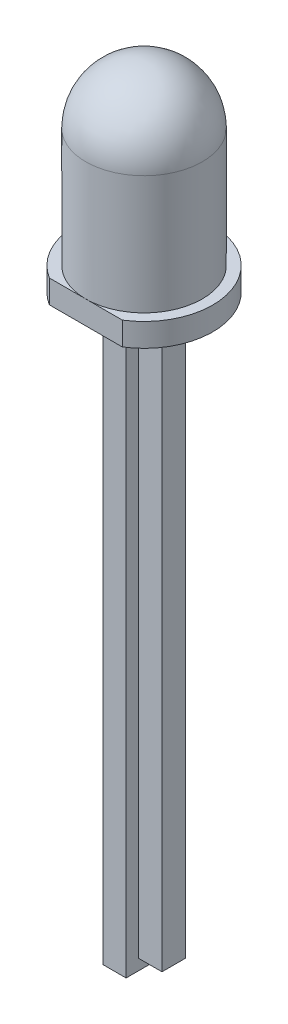
from build123d import *

# Parameters (mm, degrees)
SKETCH1_W           = 2.54
SKETCH1_H           = 1
BASE_EXTRUDE_DEPTH  = 0.381
SKETCH2_W           = 1
SKETCH2_H           = 1
BOSS_EXTRUDE1_DEPTH = 24
SKETCH7_W           = 1
SKETCH7_H           = 1
BOSS_EXTRUDE4_DEPTH = 1
FILLET5_R           = 0.254
BOSS_EXTRUDE2_DEPTH = 1
SKETCH4_R           = 2.5
BOSS_EXTRUDE3_DEPTH = 7.6
FILLET4_R           = 2.5
SKETCH6_W           = 0.032
SKETCH6_H           = 0.381
CUT_EXTRUDE1_DEPTH  = 26.509623674


with BuildPart() as part:
    # Sketch1 → Base-Extrude (new body)
    with BuildSketch(Plane(origin=(0, 0, 0), x_dir=(1, 0, 0), z_dir=(0, 1, 0))):
        with Locations((0.77, 0)):
            Rectangle(SKETCH1_W, SKETCH1_H)
    extrude(amount=BASE_EXTRUDE_DEPTH)

    # Sketch2 → Boss-Extrude1 (add)
    with BuildSketch(Plane.XZ):
        Rectangle(SKETCH2_W, SKETCH2_H)
        with Locations((1.54, 0)):
            Rectangle(SKETCH2_W, SKETCH2_H)
    extrude(amount=BOSS_EXTRUDE1_DEPTH)

    # Sketch7 → Boss-Extrude4 (add)
    with BuildSketch(Plane.XZ.offset(24)):
        Rectangle(SKETCH7_W, SKETCH7_H)
    extrude(amount=BOSS_EXTRUDE4_DEPTH)

    # Fillet5
    fillet5_edges = [part.edges().sort_by_distance(p)[0] for p in [
        (-0.5, 0.381, 0),
        (2.04, 0.381, 0),
        (0.5, 0, 0),
        (1.04, 0, 0),
    ]]
    fillet(fillet5_edges, radius=FILLET5_R)

    # Sketch3 → Boss-Extrude2 (add)
    with BuildSketch(Plane(origin=(0, 0.381, 0), x_dir=(-1, 0, 0), z_dir=(0, 1, 0))):
        with BuildLine():
            Line((-2.336045976, 2.5), (0.796045976, 2.5))
            ThreePointArc((0.796045976, 2.5), (-0.77, -2.95), (-2.336045976, 2.5))
        make_face()
    extrude(amount=BOSS_EXTRUDE2_DEPTH)

    # Sketch4 → Boss-Extrude3 (add)
    with BuildSketch(Plane(origin=(0, 1.381, 0), x_dir=(-1, 0, 0), z_dir=(0, 1, 0))):
        with Locations((-0.77, 0)):
            Circle(SKETCH4_R)
    extrude(amount=BOSS_EXTRUDE3_DEPTH)

    # Fillet4
    fillet4_edges = [part.edges().sort_by_distance(p)[0] for p in [
        (3.27, 8.981, 0),
    ]]
    fillet(fillet4_edges, radius=FILLET4_R)

    # Sketch6 → Cut-Extrude1 (cut, through all)
    with BuildSketch(Plane.XY.offset(0.5)):
        with Locations((0.77, 0.1905)):
            Rectangle(SKETCH6_W, SKETCH6_H)
    extrude(amount=-CUT_EXTRUDE1_DEPTH, mode=Mode.SUBTRACT)


solid = part.part
